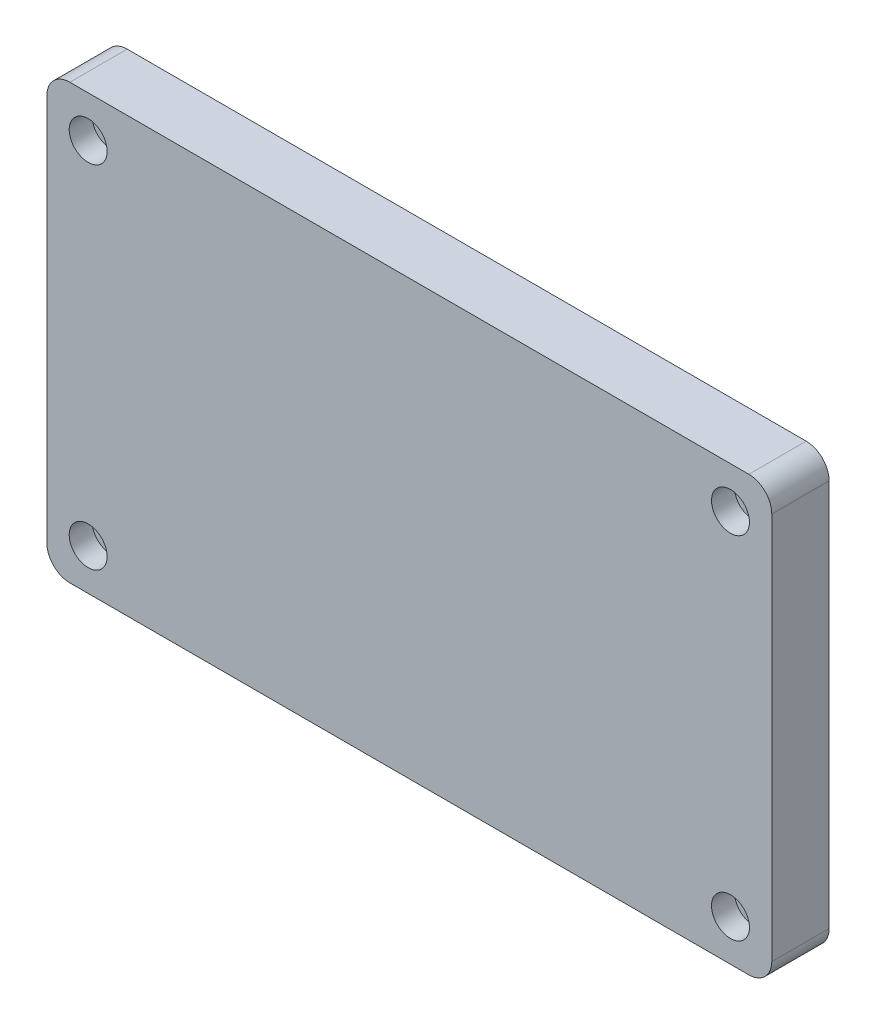
from build123d import *

# Parameters (mm, degrees)
SKETCH1_W           = 80.264
SKETCH1_H           = 48.006
BOSS_EXTRUDE1_DEPTH = 6.35
SKETCH2_R           = 2.100000118
CUT_EXTRUDE2_DEPTH  = 2.54
FILLET1_R           = 2.54


with BuildPart() as part:
    # Sketch1 → Boss-Extrude1 (new body)
    with BuildSketch(Plane.XY):
        Rectangle(SKETCH1_W, SKETCH1_H)
    extrude(amount=BOSS_EXTRUDE1_DEPTH)

    # Sketch2 → Cut-Extrude2 (cut)
    with BuildSketch(Plane.XY.offset(6.35)):
        with Locations((-35.56, -19.431)):
            Circle(SKETCH2_R)
        with Locations((35.56, -19.431)):
            Circle(SKETCH2_R)
        with Locations((-35.56, 19.431)):
            Circle(SKETCH2_R)
        with Locations((35.56, 19.431)):
            Circle(SKETCH2_R)
    extrude(amount=-CUT_EXTRUDE2_DEPTH, mode=Mode.SUBTRACT)

    # Fillet1
    fillet1_edges = [part.edges().sort_by_distance(p)[0] for p in [
        (40.132, -24.003, 3.175),
        (40.132, 24.003, 3.175),
        (-40.132, -24.003, 3.175),
        (-40.132, 24.003, 3.175),
    ]]
    fillet(fillet1_edges, radius=FILLET1_R)


solid = part.part
